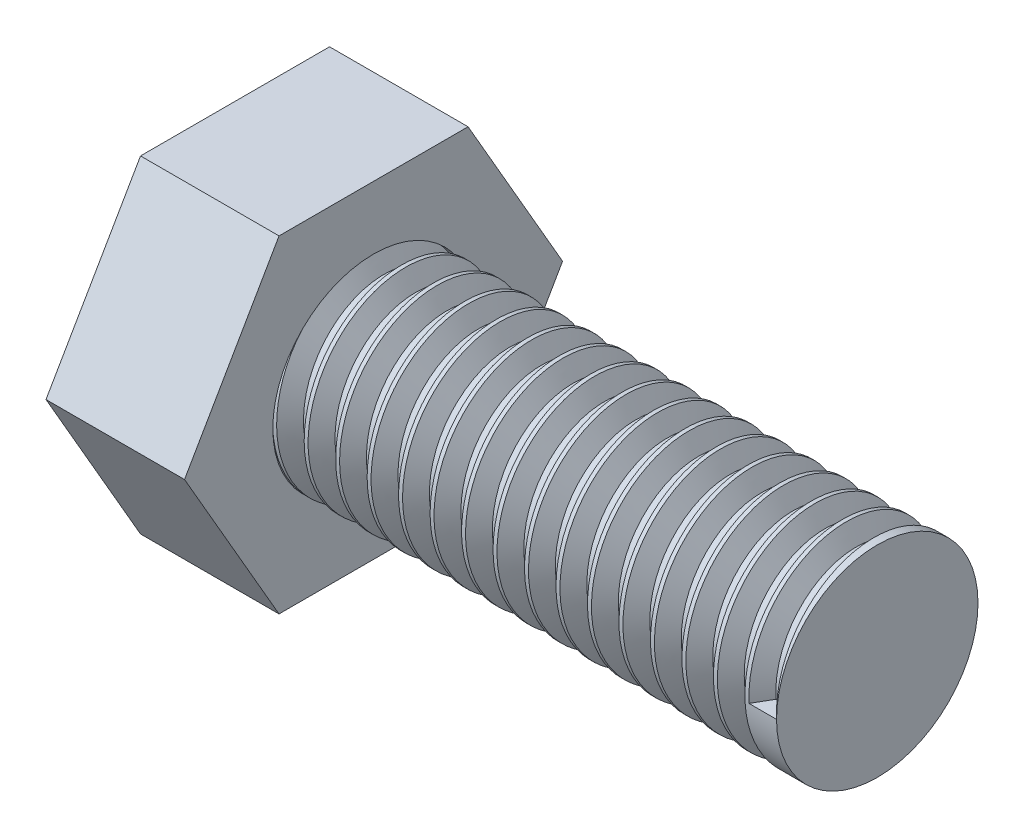
from build123d import *
from build123d.topology import SkipClean

# Parameters (mm, degrees)
SKETCH1_W           = 20
SKETCH1_H           = 4
BOSS_EXTRUDE1_DEPTH = 5.5
THREAD1_PITCH       = 1.25


with BuildPart() as part:
    # Sketch1 → Revolve1 (revolve)
    with BuildSketch(Plane.XY, mode=Mode.PRIVATE) as revolve1_sk:
        with Locations((10, 2)):
            Rectangle(SKETCH1_W, SKETCH1_H)
    revolve(revolve1_sk.sketch.rotate(Axis((0, 0, 0), (1, 0, 0)), 180), axis=Axis((0, 0, 0), (1, 0, 0)))

    # Sketch2 → Boss-Extrude1 (add)
    with BuildSketch(Plane.ZY):
        Polygon((7.505553499, 0), (3.75277675, 6.5), (-3.75277675, 6.5), (-7.505553499, 0), (-3.75277675, -6.5), (3.75277675, -6.5), align=None)
    extrude(amount=BOSS_EXTRUDE1_DEPTH)

    # Thread1: the profile of Thread Profile1 profile screwed along a right-hand helix of 16 turns, 8 arcs to a turn; built about Z, then put on its axis
    with SkipClean():  # the faces are left unmerged after this step: merging them gives an invalid solid
        thread1_z = Axis((0, 0, 0), (0, 0, 1))
        thread1_corners = [(4.0003, 0, -0.000173205), (4.0003, 0, 1.093923202), (3.323417656, 0, 0.703124998), (3.323417656, 0, 0.390624998)]
        with BuildLine(mode=Mode.PRIVATE) as thread1_profile:
            Line(thread1_corners[0], thread1_corners[1])
            Line(thread1_corners[1], thread1_corners[2])
            Line(thread1_corners[2], thread1_corners[3])
            Line(thread1_corners[3], thread1_corners[0])
        thread1_cap = Face(thread1_profile.wire())
        thread1_turn_angles = [0, 22.5, 45, 67.5, 90, 112.5, 135, 157.5, 180, 202.5, 225, 247.5, 270, 292.5, 315, 337.5, 360]
        thread1_turn_weights = [1, 0.9238795325112867, 1, 0.9238795325112867, 1, 0.9238795325112867, 1, 0.9238795325112867, 1, 0.9238795325112867, 1, 0.9238795325112867, 1, 0.9238795325112867, 1, 0.9238795325112867, 1]
        thread1_turn_rails = [Edge.make_bspline([Vector(p[0], p[1], 0).rotate(thread1_z, thread1_turn_angles[k]) / thread1_turn_weights[k] + Vector(0, 0, p[2] + THREAD1_PITCH * thread1_turn_angles[k] / 360) for k in range(17)], [0, 0, 0, 1, 1, 2, 2, 3, 3, 4, 4, 5, 5, 6, 6, 7, 7, 8, 8, 8], 2, thread1_turn_weights) for p in thread1_corners]
        thread1_turn_sides = [Face.make_surface_from_curves(thread1_turn_rails[p[0]], thread1_turn_rails[p[1]]) for p in [(0, 1), (1, 2), (2, 3), (3, 0)]]
        thread1 = Plane(origin=(20, 0, 0), x_dir=(0, 0, 1), z_dir=(-1, 0, 0)) * Solid(Shell([*[p.moved(Location((0, 0, THREAD1_PITCH * i))) for i in range(16) for p in thread1_turn_sides], thread1_cap, thread1_cap.rotate(thread1_z, 5760).moved(Location((0, 0, THREAD1_PITCH * 5760 / 360)))]))
        add(thread1, mode=Mode.SUBTRACT)


solid = part.part
